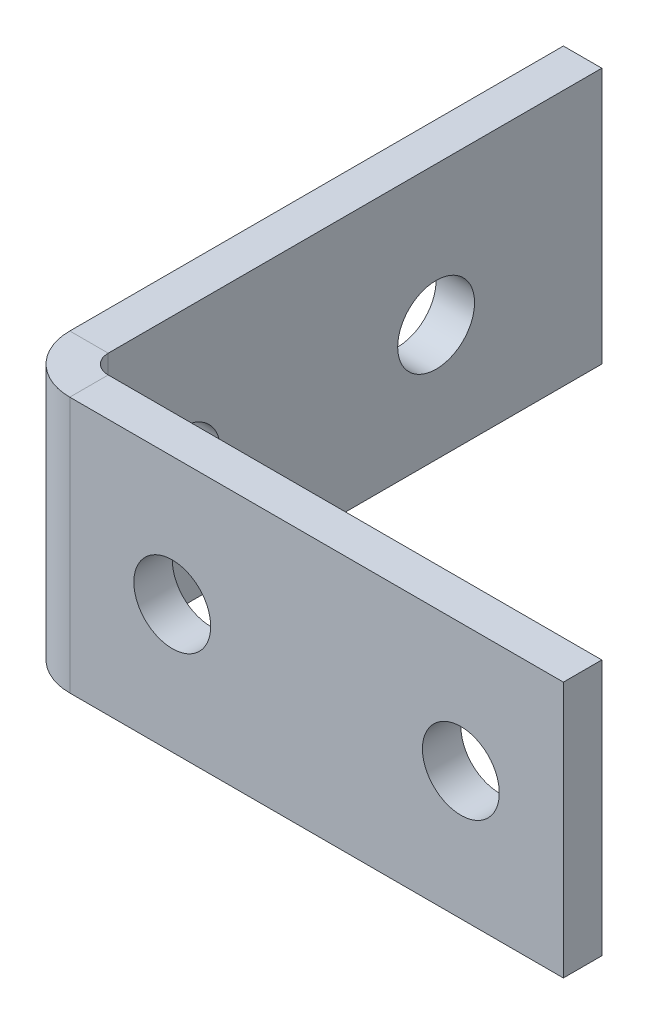
from build123d import *

# Parameters (mm, degrees)
BASE_FLANGE1_DEPTH                 = 10
F_3_0MM_TRANSITIONAL_DOWEL_HOLE1_D = 3
F_3_0MM_PRESS_DOWEL_HOLE1_D        = 3


# Sheet-metal steps are written as plain solids
with BuildPart() as part:
    # Sketch1 → Base-Flange1 (new body)
    with BuildSketch(Plane(origin=(0, 0, 0), x_dir=(1, 0, 0), z_dir=(0, 1, 0))):
        with BuildLine():
            Line((0, 0), (0, -19.2634))
            ThreePointArc((0, -19.2634), (0.215745145, -19.784254855), (0.7366, -20))
            Line((0.7366, -20), (20, -20))
            Line((20, -20), (20, -21.5))
            Line((20, -21.5), (0.7366, -21.5))
            ThreePointArc((0.7366, -21.5), (-0.844915027, -20.844915027), (-1.5, -19.2634))
            Line((-1.5, -19.2634), (-1.5, 0))
            Line((-1.5, 0), (0, 0))
        make_face()
    extrude(amount=BASE_FLANGE1_DEPTH)

    # Ø3.0mm Transitional Dowel Hole1 (through all)
    with Locations(Plane.ZY.offset(1.5)):
        with Locations((16.387023366, 4.560762846), (6.466703516, 4.560762846)):
            Hole(F_3_0MM_TRANSITIONAL_DOWEL_HOLE1_D / 2)

    # Ø3.0mm Press Dowel Hole1 (through all)
    with Locations(Plane(origin=(0, 0, 20), x_dir=(-1, 0, 0), z_dir=(0, 0, -1))):
        with Locations((-4.7366, 5), (-16, 5)):
            Hole(F_3_0MM_PRESS_DOWEL_HOLE1_D / 2)


solid = part.part
